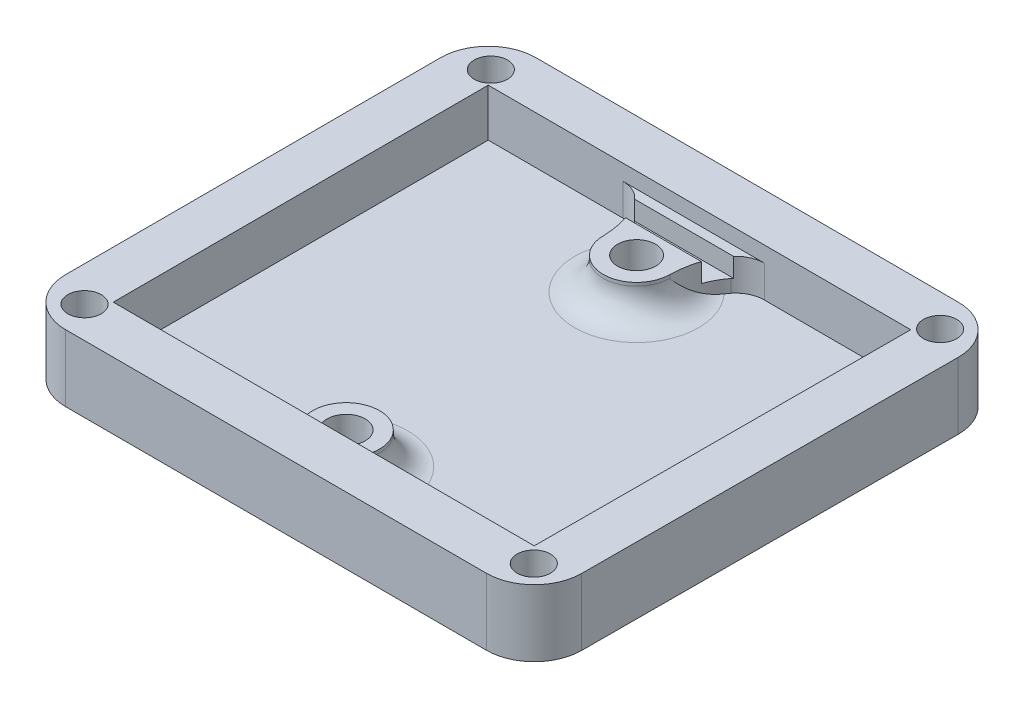
from build123d import *

# Parameters (mm, degrees)
CROQUIS1_R              = 1.3
SALIENTE_EXTRUIR1_DEPTH = 5
VACIADO1_START          = -5
VACIADO1_DEPTH          = 5
VACIADO1_2_OUTLINE_R    = 1.3
VACIADO1_2_DEPTH        = 5
VACIADO1_3_OUTLINE_R    = 1.3
VACIADO1_3_DEPTH        = 5
SALIENTE_EXTRUIR2_START = -1.65
CROQUIS2_R              = 3.5
CROQUIS2_R_2            = 2
SALIENTE_EXTRUIR2_DEPTH = 3.35
CROQUIS3_R              = 2
CORTAR_EXTRUIR1_DEPTH   = 5
REDONDEO1_R             = 5
CROQUIS4_R              = 1.75
CORTAR_EXTRUIR2_DEPTH   = 4
REDONDEO2_R             = 3
CROQUIS5_W              = 10.71017297
CROQUIS5_H              = 2.16113269
CORTAR_EXTRUIR3_DEPTH   = 2
REDONDEO3_R             = 5
CROQUIS6_W              = 134.393326308
CROQUIS6_H              = 117.100902836
CORTAR_EXTRUIR4_DEPTH   = 3


# Read off the part's stored shape, not the designer's step: Vaciado1
with BuildPart() as part:
    # Croquis1 → Saliente-Extruir1 (new body)
    with BuildSketch(Plane(origin=(0, 0, 0), x_dir=(1, 0, 0), z_dir=(0, 1, 0))):
        Polygon((-21.910650365, -18.655769069), (22.326249635, -18.714369069), (22.443043136, 20.685314639), (-21.956956864, 20.744230931), align=None)
        with Locations(Location((0.268043136, -16.390769069, 0), (0, 0, 270))):
            Circle(CROQUIS1_R, mode=Mode.SUBTRACT)
        with Locations(Location((-0.366956864, 14.724230931, 0), (0, 0, 270))):
            Circle(CROQUIS1_R, mode=Mode.SUBTRACT)
    extrude(amount=SALIENTE_EXTRUIR1_DEPTH)

    # Vaciado1 outline → Vaciado1 (add)
    with BuildSketch(Plane(origin=(0, 0, 0), x_dir=(1, 0, 0), z_dir=(0, 1, 0)).offset(VACIADO1_START)):
        Polygon((-26.904785129, -23.649157796), (27.311430385, -23.720977255), (27.457867021, 25.678664653), (-26.962844589, 25.750877863), align=None)
    extrude(amount=VACIADO1_DEPTH)

    # Vaciado1 2 outline → Vaciado1 2 (add)
    # profile 1 of 3: a face of its own
    with BuildSketch(Plane(origin=(0, 0, 0), x_dir=(1, 0, 0), z_dir=(0, 1, 0))):
        Polygon((-26.904785129, -23.649157796), (27.311430385, -23.720977255), (27.457867021, 25.678664653), (-26.962844589, 25.750877863), align=None)
        Polygon((22.443043136, 20.685314639), (22.326249635, -18.714369069), (-21.910650365, -18.655769069), (-21.956956864, 20.744230931), align=None, mode=Mode.SUBTRACT)
    # profile 2 of 3: a face of its own
    with BuildSketch(Plane(origin=(0, 0, 0), x_dir=(1, 0, 0), z_dir=(0, 1, 0))):
        with Locations((0.268043136, -16.390769069)):
            Circle(VACIADO1_2_OUTLINE_R)
    # profile 3 of 3: a face of its own
    with BuildSketch(Plane(origin=(0, 0, 0), x_dir=(1, 0, 0), z_dir=(0, 1, 0))):
        with Locations((-0.366956864, 14.724230931)):
            Circle(VACIADO1_2_OUTLINE_R)
    extrude(amount=VACIADO1_2_DEPTH)

    # Vaciado1 3 outline → Vaciado1 3 (cut)
    with BuildSketch(Plane(origin=(0, 0, 0), x_dir=(1, 0, 0), z_dir=(0, 1, 0))):
        Polygon((-21.910650365, -18.655769069), (22.326249635, -18.714369069), (22.443043136, 20.685314639), (-21.956956864, 20.744230931), align=None)
        with Locations((0.268043136, -16.390769069)):
            Circle(VACIADO1_3_OUTLINE_R, mode=Mode.SUBTRACT)
        with Locations((-0.366956864, 14.724230931)):
            Circle(VACIADO1_3_OUTLINE_R, mode=Mode.SUBTRACT)
    extrude(amount=VACIADO1_3_DEPTH, mode=Mode.SUBTRACT)

    # Croquis2 → Saliente-Extruir2 (add)
    # profile 1 of 2: a face of its own
    with BuildSketch(Plane(origin=(0, 5, 0), x_dir=(1, 0, 0), z_dir=(0, 1, 0)).offset(SALIENTE_EXTRUIR2_START)):
        with Locations((0.268043136, -16.390769069)):
            Circle(CROQUIS2_R)
        with Locations(Location((0.268043136, -16.390769069, 0), (0, 0, 270))):
            Circle(CROQUIS2_R_2, mode=Mode.SUBTRACT)
    # profile 2 of 2: a face of its own
    with BuildSketch(Plane(origin=(0, 5, 0), x_dir=(1, 0, 0), z_dir=(0, 1, 0)).offset(SALIENTE_EXTRUIR2_START)):
        with BuildLine():
            Line((-6.64056044, 20.723906938), (5.906646712, 20.723906938))
            add(Edge.make_bspline(
                [(3.133043136, 14.724230931), (3.271851145, 18.789959359), (5.906646712, 20.723906938)],
                knots=[0, 0, 0, 0.918206359, 0.918206359, 0.918206359], degree=2))
            ThreePointArc((3.133043136, 14.724230931), (-0.366956864, 11.224230931), (-3.866956864, 14.724230931))
            add(Edge.make_bspline(
                [(-3.866956864, 14.724230931), (-4.005764873, 18.789959359), (-6.64056044, 20.723906938)],
                knots=[0, 0, 0, 0.918206359, 0.918206359, 0.918206359], degree=2))
        make_face()
        with Locations(Location((-0.366956864, 14.724230931, 0), (0, 0, 270))):
            Circle(CROQUIS2_R_2, mode=Mode.SUBTRACT)
    extrude(amount=-SALIENTE_EXTRUIR2_DEPTH)

    # Croquis3 → Cortar-Extruir1 (cut)
    with BuildSketch(Plane(origin=(0, 5, 0), x_dir=(1, 0, 0), z_dir=(0, 1, 0))):
        with Locations(Location((-0.366956864, 14.724230931, 0), (0, 0, 270))):
            Circle(CROQUIS3_R)
        with Locations(Location((0.268043136, -16.390769069, 0), (0, 0, 270))):
            Circle(CROQUIS3_R)
    extrude(amount=-CORTAR_EXTRUIR1_DEPTH, mode=Mode.SUBTRACT)

    # Redondeo1
    redondeo1_edges = [part.edges().sort_by_distance(p)[0] for p in [
        (-26.962844589, 0, -25.750877863),
        (27.457867021, 0, -25.678664653),
    ]]
    fillet(redondeo1_edges, radius=REDONDEO1_R)

    # Croquis4 → Cortar-Extruir2 (cut)
    with BuildSketch(Plane(origin=(0, 5, 0), x_dir=(1, 0, 0), z_dir=(0, 1, 0))):
        with Locations(Location((-23.233010561, -20.350621098, 0), (0, 0, 270))):
            Circle(CROQUIS4_R)
        with Locations(Location((23.918815335, -20.350621098, 0), (0, 0, 270))):
            Circle(CROQUIS4_R)
        with Locations(Location((23.918815335, 22.291734245, 0), (0, 0, 270))):
            Circle(CROQUIS4_R)
        with Locations(Location((-23.233010561, 22.291734245, 0), (0, 0, 270))):
            Circle(CROQUIS4_R)
    extrude(amount=-CORTAR_EXTRUIR2_DEPTH, mode=Mode.SUBTRACT)

    # Redondeo2
    # the kernel refuses this fillet: 3 mm, written as the material it adds along each edge
    with BuildSketch(Plane(origin=(0.268043136, 0, 16.390769069), x_dir=(-0.004466262982364763, 0, 0.9999900261977478), z_dir=(0.9999900261977478, 0, 0.004466262982364763))) as redondeo2_piece_1_section:
        with BuildLine():
            CenterArc((3.5 + REDONDEO2_R, -REDONDEO2_R), REDONDEO2_R, 90, 90)
            Line((3.5, -REDONDEO2_R), (3.5 - REDONDEO2_R * 0.02, -REDONDEO2_R))
            Line((3.5 - REDONDEO2_R * 0.02, -REDONDEO2_R), (3.5 - REDONDEO2_R * 0.02, REDONDEO2_R * 0.02))
            Line((3.5 - REDONDEO2_R * 0.02, REDONDEO2_R * 0.02), (3.5 + REDONDEO2_R, REDONDEO2_R * 0.02))
            Line((3.5 + REDONDEO2_R, REDONDEO2_R * 0.02), (3.5 + REDONDEO2_R, 0))
        make_face()
    redondeo2_piece_1 = revolve(axis=Axis((0.268043136, 0, 16.390769069), (0, -1, 0)), revolution_arc=359.64, mode=Mode.PRIVATE)
    redondeo2_piece_1 = split(redondeo2_piece_1, bisect_by=Plane(origin=(0.265003809, 0.854230432, 18.685144847), z_dir=(0.0013246847899521655, 0, -0.9999991226047188)), keep=Keep.TOP, mode=Mode.PRIVATE)
    add(redondeo2_piece_1)
    with BuildSketch(Plane(origin=(-0.366956864, 0, -14.724230931), x_dir=(0.003141587485879655, 0, -0.9999950652018582), z_dir=(-0.9999950652018582, 0, -0.003141587485879655))) as redondeo2_piece_2:
        with BuildLine():
            CenterArc((3.5 + REDONDEO2_R, -REDONDEO2_R), REDONDEO2_R, 90, 90)
            Line((3.5, -REDONDEO2_R), (3.5 - REDONDEO2_R * 0.02, -REDONDEO2_R))
            Line((3.5 - REDONDEO2_R * 0.02, -REDONDEO2_R), (3.5 - REDONDEO2_R * 0.02, REDONDEO2_R * 0.02))
            Line((3.5 - REDONDEO2_R * 0.02, REDONDEO2_R * 0.02), (3.5 + REDONDEO2_R, REDONDEO2_R * 0.02))
            Line((3.5 + REDONDEO2_R, REDONDEO2_R * 0.02), (3.5 + REDONDEO2_R, 0))
        make_face()
    revolve(axis=Axis((-0.366956864, 0, -14.724230931), (0, -1, 0)), revolution_arc=359.64)
    with BuildSketch(Plane(origin=(5.884103635, 0, -20.707287416), x_dir=(0.9999991196116186, -2.6407019803235333e-15, 0.001326942345288348), z_dir=(0, 1, 0))) as redondeo2_piece_3:
        with BuildLine():
            CenterArc((1.172300158, -3), REDONDEO2_R, 90, 51.414502479)
            Line((-1.172734926, -1.128954716), (-1.219635628, -1.09153381))
            ThreePointArc((-1.219635628, -1.09153381), (-0.664607818, -0.483065198), (-0.035769429, 0.048172066))
            Line((-0.035769429, 0.048172066), (0, 0.06))
            Line((0, 0.06), (1.172300158, 0.06))
            Line((1.172300158, 0.06), (1.172300158, 0))
        make_face()
    extrude(amount=3.35)
    with BuildSketch(Plane(origin=(-6.64056044, 3.35, -20.723906938), x_dir=(-0.9999991196114262, 0, -0.0013269424902280428), z_dir=(0, -1, 0))) as redondeo2_piece_4:
        with BuildLine():
            CenterArc((1.1576947, -3), REDONDEO2_R, 89.999999992, 50.80553693)
            Line((-1.167321988, -1.104136767), (-1.213822322, -1.066219502))
            ThreePointArc((-1.213822322, -1.066219502), (-0.660180294, -0.471028769), (-0.035438663, 0.048415919))
            Line((-0.035438663, 0.048415919), (0, 0.06))
            Line((0, 0.06), (1.157694701, 0.06))
            Line((1.157694701, 0.06), (1.157694701, 0))
        make_face()
    extrude(amount=3.35)

    # Croquis5 → Cortar-Extruir3 (cut)
    with BuildSketch(Plane(origin=(0, 3.35, 0), x_dir=(1, 0, 0), z_dir=(0, 1, 0))):
        with Locations((-0.296000529, 18.628716842)):
            Rectangle(CROQUIS5_W, CROQUIS5_H)
    extrude(amount=-CORTAR_EXTRUIR3_DEPTH, mode=Mode.SUBTRACT)

    # Redondeo3
    redondeo3_edges = [part.edges().sort_by_distance(p)[0] for p in [
        (-26.904785129, 0, 23.649157796),
        (27.311430385, 0, 23.720977255),
    ]]
    fillet(redondeo3_edges, radius=REDONDEO3_R)

    # Croquis6 → Cortar-Extruir4 (cut)
    with BuildSketch(Plane.XZ.offset(5)):
        with Locations((-0.420435638, 0)):
            Rectangle(CROQUIS6_W, CROQUIS6_H)
    extrude(amount=-CORTAR_EXTRUIR4_DEPTH, mode=Mode.SUBTRACT)


solid = part.part
